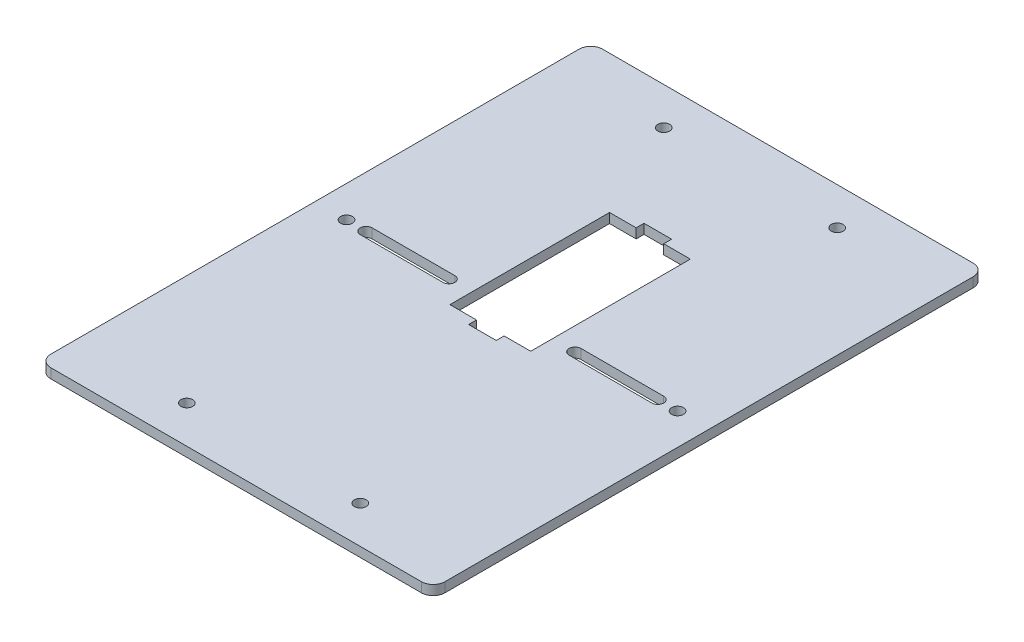
from build123d import *

# Parameters (mm, degrees)
BASE_FLANGE2_DEPTH = 2.45
SKETCH10_R         = 1.5
CUT_EXTRUDE1_DEPTH = 2.45


# Sheet-metal steps are written as plain solids
with BuildPart() as part:
    # Sketch2 → Base-Flange2 (new body)
    with BuildSketch(Plane(origin=(0, 0, 0), x_dir=(1, 0, 0), z_dir=(0, 1, 0))):
        with BuildLine():
            Line((-47, -70), (47, -70))
            ThreePointArc((47, -70), (49.121320344, -69.121320344), (50, -67))
            Line((50, -67), (50, 67))
            ThreePointArc((50, 67), (49.121320344, 69.121320344), (47, 70))
            Line((47, 70), (-47, 70))
            ThreePointArc((-47, 70), (-49.121320344, 69.121320344), (-50, 67))
            Line((-50, 67), (-50, -67))
            ThreePointArc((-50, -67), (-49.121320344, -69.121320344), (-47, -70))
        make_face()
    extrude(amount=-BASE_FLANGE2_DEPTH)

    # Sketch10 → Cut-Extrude1 (cut)
    with BuildSketch(Plane(origin=(0, 0, 0), x_dir=(1, 0, 0), z_dir=(0, 1, 0))):
        with Locations(Location((42, 0, 0), (0, 0, 270))):
            Circle(SKETCH10_R)
        with Locations(Location((-42, 0, 0), (0, 0, 270))):
            Circle(SKETCH10_R)
        with Locations(Location((22, 60.5, 0), (0, 0, 270))):
            Circle(SKETCH10_R)
        with Locations(Location((-22, 60.5, 0), (0, 0, 90))):
            Circle(SKETCH10_R)
        with Locations(Location((22, -60.5, 0), (0, 0, 90))):
            Circle(SKETCH10_R)
        with Locations(Location((-22, -60.5, 0), (0, 0, 270))):
            Circle(SKETCH10_R)
        Polygon((-10.25, -5.5), (-3.5, -5.5), (-3.5, -7.5), (3.5, -7.5), (3.5, -5.5), (10.25, -5.5), (10.25, 35), (3.5, 35), (3.5, 37), (-3.5, 37), (-3.5, 35), (-10.25, 35), align=None)
        with BuildLine():
            Line((-37, 1.5), (-16, 1.5))
            ThreePointArc((-16, 1.5), (-14.5, 0), (-16, -1.5))
            Line((-16, -1.5), (-37, -1.5))
            ThreePointArc((-37, -1.5), (-38.5, 0), (-37, 1.5))
        make_face()
        with BuildLine():
            Line((37, 1.5), (16, 1.5))
            ThreePointArc((16, 1.5), (14.5, 0), (16, -1.5))
            Line((16, -1.5), (37, -1.5))
            ThreePointArc((37, -1.5), (38.5, 0), (37, 1.5))
        make_face()
    extrude(amount=-CUT_EXTRUDE1_DEPTH, mode=Mode.SUBTRACT)


solid = part.part
